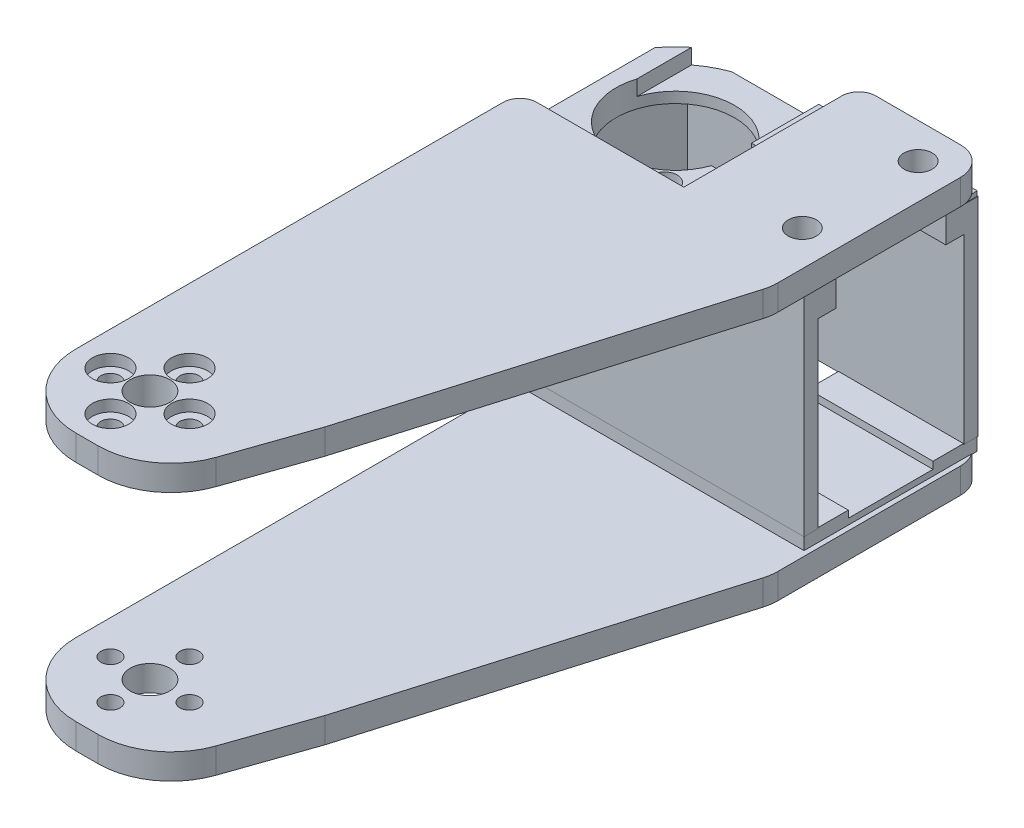
from build123d import *

# Parameters (mm, degrees)
BOSS_1_DEPTH    = 4.5
S_CYL2_R        = 9.5
BOSS_2_DEPTH    = 3.2
BOSS_3_DEPTH    = 4.5
S_BOX4_W        = 2.5
S_BOX4_H        = 36.8
BOSS_4_DEPTH    = 30.8
S_BOX5_W        = 51.4
S_BOX5_H        = 36.8
BOSS_5_DEPTH    = 2.5
S_BOX6_W        = 51.4
S_BOX6_H        = 36.8
BOSS_6_DEPTH    = 2.5
S_BOX7_W        = 51.4
S_BOX7_H        = 4.6
BOSS_7_DEPTH    = 30.8
S_BOX8_W        = 22.13
S_BOX8_H        = 2.4
BOSS_8_DEPTH    = 30.66
S_BOX9_W        = 29.16
S_BOX9_H        = 2.4
BOSS_9_DEPTH    = 1.83
S_BOX10_W       = 22.13
S_BOX10_H       = 0.95
BOSS_10_DEPTH   = 30.66
S_BOX11_W       = 29.16
S_BOX11_H       = 0.95
BOSS_11_DEPTH   = 1.83
S_HOLE12_R      = 3.5
HOLE_12_DEPTH   = 4.7
S_HOLE13_R      = 1.7
HOLE_13_DEPTH   = 4.7
S_HOLE14_R      = 1.7
HOLE_14_DEPTH   = 4.7
S_HOLE15_R      = 1.7
HOLE_15_DEPTH   = 4.7
S_HOLE16_R      = 1.7
HOLE_16_DEPTH   = 4.7
S_HOLE17_R      = 3.2
HOLE_17_DEPTH   = 1.6
S_HOLE18_R      = 3.2
HOLE_18_DEPTH   = 1.6
S_HOLE19_R      = 3.2
HOLE_19_DEPTH   = 1.6
S_HOLE20_R      = 3.2
HOLE_20_DEPTH   = 1.6
S_HOLE21_R      = 3.5
HOLE_21_DEPTH   = 7.9
S_HOLE22_R      = 1.7
HOLE_22_DEPTH   = 7.9
S_HOLE23_R      = 1.7
HOLE_23_DEPTH   = 7.9
S_HOLE24_R      = 1.7
HOLE_24_DEPTH   = 7.9
S_HOLE25_R      = 1.7
HOLE_25_DEPTH   = 7.9
S_HOLE26_R      = 3.2
HOLE_26_DEPTH   = 2.1
S_HOLE27_R      = 3.2
HOLE_27_DEPTH   = 2.1
S_HOLE28_R      = 3.2
HOLE_28_DEPTH   = 2.1
S_HOLE29_R      = 3.2
HOLE_29_DEPTH   = 2.1
S_CUT30_W       = 6.8
S_CUT30_H       = 1
POCKET_30_DEPTH = 10
S_HOLE31_R      = 10.5
HOLE_31_DEPTH   = 4.8
S_CUT32_W       = 19.5
S_CUT32_H       = 4.75
POCKET_32_DEPTH = 19.4
S_CUT33_W       = 8.3
S_CUT33_H       = 4.75
POCKET_33_DEPTH = 19.4
S_CUT34_W       = 11
S_CUT34_H       = 4.75
POCKET_34_DEPTH = 7
S_CUT35_W       = 20
S_CUT35_H       = 2.9
POCKET_35_DEPTH = 15.9
S_HOLE36_R      = 1.1
HOLE_36_DEPTH   = 4.8
S_HOLE37_R      = 2.3
HOLE_37_DEPTH   = 1.7
S_HOLE38_R      = 1.1
HOLE_38_DEPTH   = 4.8
S_HOLE39_R      = 2.3
HOLE_39_DEPTH   = 1.7
S_HOLE40_R      = 1.1
HOLE_40_DEPTH   = 4.8
S_HOLE41_R      = 2.3
HOLE_41_DEPTH   = 1.7
S_CUT42_W       = 30.6
S_CUT42_H       = 1.55
POCKET_42_DEPTH = 15
S_HOLE43_R      = 2.5
HOLE_43_DEPTH   = 5.3
S_HOLE44_R      = 2.5
HOLE_44_DEPTH   = 5.3
CUT_45_DEPTH    = 4.9
CUT_46_DEPTH    = 32


with BuildPart() as part:
    # S_prism1 → Boss_1 (new body)
    with BuildSketch(Plane(origin=(0, -23.3, 0), x_dir=(1, 0, 0), z_dir=(0, 1, 0))):
        with BuildLine():
            Line((-0.1, -13), (3.8289, -13))
            ThreePointArc((3.8289, -13), (11.303548347, -10.613765629), (16.0129, -4.3379))
            Line((16.0129, -4.3379), (21, 10))
            Line((21, 10), (38.6729, 69.8916))
            ThreePointArc((38.6729, 69.8916), (38.917799599, 71.011897227), (39, 72.1557))
            Line((39, 72.1557), (39, 104.5))
            ThreePointArc((39, 104.5), (37.5355, 108.0355), (34, 109.5))
            Line((34, 109.5), (19, 109.5))
            ThreePointArc((19, 109.5), (16.8787, 108.6213), (16, 106.5))
            Line((16, 106.5), (16, 78.5))
            Line((16, 78.5), (-10, 78.5))
            ThreePointArc((-10, 78.5), (-12.1213, 77.6213), (-13, 75.5))
            Line((-13, 75.5), (-13, -0.1))
            ThreePointArc((-13, -0.1), (-9.2217, -9.2217), (-0.1, -13))
        make_face()
    extrude(amount=BOSS_1_DEPTH)



with BuildPart() as body_2:
    # S_cyl2 → Boss_2 (new body)
    with BuildSketch(Plane(origin=(0, 17.75, 0), x_dir=(1, 0, 0), z_dir=(0, 1, 0))):
        Circle(S_CYL2_R)
    extrude(amount=BOSS_2_DEPTH)

    # S_prism3 → Boss_3 (add)
    with BuildSketch(Plane(origin=(0, 20.95, 0), x_dir=(1, 0, 0), z_dir=(0, 1, 0))):
        with BuildLine():
            Line((-0.1, -13), (3.8289, -13))
            ThreePointArc((3.8289, -13), (11.303548347, -10.613765629), (16.0129, -4.3379))
            Line((16.0129, -4.3379), (21, 10))
            Line((21, 10), (38.6729, 69.8916))
            ThreePointArc((38.6729, 69.8916), (38.917799599, 71.011897227), (39, 72.1557))
            Line((39, 72.1557), (39, 104.5))
            ThreePointArc((39, 104.5), (37.5355, 108.0355), (34, 109.5))
            Line((34, 109.5), (19, 109.5))
            ThreePointArc((19, 109.5), (16.8787, 108.6213), (16, 106.5))
            Line((16, 106.5), (16, 78.5))
            Line((16, 78.5), (-10, 78.5))
            ThreePointArc((-10, 78.5), (-12.1213, 77.6213), (-13, 75.5))
            Line((-13, 75.5), (-13, -0.1))
            ThreePointArc((-13, -0.1), (-9.2217, -9.2217), (-0.1, -13))
        make_face()
    extrude(amount=BOSS_3_DEPTH)


with BuildPart() as body_3:
    # S_box4 → Boss_4 (new body)
    with BuildSketch(Plane.XY.offset(-108.4)):
        with Locations((-11.95, 1.8)):
            Rectangle(S_BOX4_W, S_BOX4_H)
    extrude(amount=BOSS_4_DEPTH)

    # S_box5 → Boss_5 (add)
    with BuildSketch(Plane.XY.offset(-108.4)):
        with Locations((12.5, 1.8)):
            Rectangle(S_BOX5_W, S_BOX5_H)
    extrude(amount=BOSS_5_DEPTH)

    # S_box6 → Boss_6 (add)
    with BuildSketch(Plane.XY.offset(-80.1)):
        with Locations((12.5, 1.8)):
            Rectangle(S_BOX6_W, S_BOX6_H)
    extrude(amount=BOSS_6_DEPTH)

    # S_box7 → Boss_7 (add)
    with BuildSketch(Plane.XY.offset(-108.4)):
        with Locations((12.5, 17.9)):
            Rectangle(S_BOX7_W, S_BOX7_H)
    extrude(amount=BOSS_7_DEPTH)


with BuildPart() as part_1:
    add(part.part)

    add(body_3.part)  # Boss_8 merges body 3
    # S_box8 → Boss_8 (add)
    with BuildSketch(Plane.XY.offset(-108.33)):
        with Locations((27.065, -17.7)):
            Rectangle(S_BOX8_W, S_BOX8_H)
    extrude(amount=BOSS_8_DEPTH)

    # S_box9 → Boss_9 (add)
    with BuildSketch(Plane.XY.offset(-79.5)):
        with Locations((1.45, -17.7)):
            Rectangle(S_BOX9_W, S_BOX9_H)
    extrude(amount=BOSS_9_DEPTH)


    add(body_2.part)  # Boss_10 merges body 2
    # S_box10 → Boss_10 (add)
    with BuildSketch(Plane.XY.offset(-108.33)):
        with Locations((27.065, 20.575)):
            Rectangle(S_BOX10_W, S_BOX10_H)
    extrude(amount=BOSS_10_DEPTH)

    # S_box11 → Boss_11 (add)
    with BuildSketch(Plane.XY.offset(-79.5)):
        with Locations((1.45, 20.575)):
            Rectangle(S_BOX11_W, S_BOX11_H)
    extrude(amount=BOSS_11_DEPTH)

    # S_hole12 → Hole_12 (cut)
    with BuildSketch(Plane(origin=(0, -23.4, 0), x_dir=(1, 0, 0), z_dir=(0, 1, 0))):
        Circle(S_HOLE12_R)
    extrude(amount=HOLE_12_DEPTH, mode=Mode.SUBTRACT)

    # S_hole13 → Hole_13 (cut)
    with BuildSketch(Plane(origin=(0, -23.4, 0), x_dir=(1, 0, 0), z_dir=(0, 1, 0))):
        with Locations((7, 0)):
            Circle(S_HOLE13_R)
    extrude(amount=HOLE_13_DEPTH, mode=Mode.SUBTRACT)

    # S_hole14 → Hole_14 (cut)
    with BuildSketch(Plane(origin=(0, -23.4, 0), x_dir=(1, 0, 0), z_dir=(0, 1, 0))):
        with Locations((0, -7)):
            Circle(S_HOLE14_R)
    extrude(amount=HOLE_14_DEPTH, mode=Mode.SUBTRACT)

    # S_hole15 → Hole_15 (cut)
    with BuildSketch(Plane(origin=(0, -23.4, 0), x_dir=(1, 0, 0), z_dir=(0, 1, 0))):
        with Locations((-7, 0)):
            Circle(S_HOLE15_R)
    extrude(amount=HOLE_15_DEPTH, mode=Mode.SUBTRACT)

    # S_hole16 → Hole_16 (cut)
    with BuildSketch(Plane(origin=(0, -23.4, 0), x_dir=(1, 0, 0), z_dir=(0, 1, 0))):
        with Locations((0, 7)):
            Circle(S_HOLE16_R)
    extrude(amount=HOLE_16_DEPTH, mode=Mode.SUBTRACT)

    # S_hole17 → Hole_17 (cut)
    with BuildSketch(Plane(origin=(0, -23.4, 0), x_dir=(1, 0, 0), z_dir=(0, 1, 0))):
        with Locations((7, 0)):
            Circle(S_HOLE17_R)
    extrude(amount=HOLE_17_DEPTH, mode=Mode.SUBTRACT)

    # S_hole18 → Hole_18 (cut)
    with BuildSketch(Plane(origin=(0, -23.4, 0), x_dir=(1, 0, 0), z_dir=(0, 1, 0))):
        with Locations((0, -7)):
            Circle(S_HOLE18_R)
    extrude(amount=HOLE_18_DEPTH, mode=Mode.SUBTRACT)

    # S_hole19 → Hole_19 (cut)
    with BuildSketch(Plane(origin=(0, -23.4, 0), x_dir=(1, 0, 0), z_dir=(0, 1, 0))):
        with Locations((-7, 0)):
            Circle(S_HOLE19_R)
    extrude(amount=HOLE_19_DEPTH, mode=Mode.SUBTRACT)

    # S_hole20 → Hole_20 (cut)
    with BuildSketch(Plane(origin=(0, -23.4, 0), x_dir=(1, 0, 0), z_dir=(0, 1, 0))):
        with Locations((0, 7)):
            Circle(S_HOLE20_R)
    extrude(amount=HOLE_20_DEPTH, mode=Mode.SUBTRACT)

    # S_hole21 → Hole_21 (cut)
    with BuildSketch(Plane(origin=(0, 17.65, 0), x_dir=(1, 0, 0), z_dir=(0, 1, 0))):
        Circle(S_HOLE21_R)
    extrude(amount=HOLE_21_DEPTH, mode=Mode.SUBTRACT)

    # S_hole22 → Hole_22 (cut)
    with BuildSketch(Plane(origin=(0, 17.65, 0), x_dir=(1, 0, 0), z_dir=(0, 1, 0))):
        with Locations((7, 0)):
            Circle(S_HOLE22_R)
    extrude(amount=HOLE_22_DEPTH, mode=Mode.SUBTRACT)

    # S_hole23 → Hole_23 (cut)
    with BuildSketch(Plane(origin=(0, 17.65, 0), x_dir=(1, 0, 0), z_dir=(0, 1, 0))):
        with Locations((0, -7)):
            Circle(S_HOLE23_R)
    extrude(amount=HOLE_23_DEPTH, mode=Mode.SUBTRACT)

    # S_hole24 → Hole_24 (cut)
    with BuildSketch(Plane(origin=(0, 17.65, 0), x_dir=(1, 0, 0), z_dir=(0, 1, 0))):
        with Locations((-7, 0)):
            Circle(S_HOLE24_R)
    extrude(amount=HOLE_24_DEPTH, mode=Mode.SUBTRACT)

    # S_hole25 → Hole_25 (cut)
    with BuildSketch(Plane(origin=(0, 17.65, 0), x_dir=(1, 0, 0), z_dir=(0, 1, 0))):
        with Locations((0, 7)):
            Circle(S_HOLE25_R)
    extrude(amount=HOLE_25_DEPTH, mode=Mode.SUBTRACT)

    # S_hole26 → Hole_26 (cut)
    with BuildSketch(Plane(origin=(0, 23.45, 0), x_dir=(1, 0, 0), z_dir=(0, 1, 0))):
        with Locations((7, 0)):
            Circle(S_HOLE26_R)
    extrude(amount=HOLE_26_DEPTH, mode=Mode.SUBTRACT)

    # S_hole27 → Hole_27 (cut)
    with BuildSketch(Plane(origin=(0, 23.45, 0), x_dir=(1, 0, 0), z_dir=(0, 1, 0))):
        with Locations((0, -7)):
            Circle(S_HOLE27_R)
    extrude(amount=HOLE_27_DEPTH, mode=Mode.SUBTRACT)

    # S_hole28 → Hole_28 (cut)
    with BuildSketch(Plane(origin=(0, 23.45, 0), x_dir=(1, 0, 0), z_dir=(0, 1, 0))):
        with Locations((-7, 0)):
            Circle(S_HOLE28_R)
    extrude(amount=HOLE_28_DEPTH, mode=Mode.SUBTRACT)

    # S_hole29 → Hole_29 (cut)
    with BuildSketch(Plane(origin=(0, 23.45, 0), x_dir=(1, 0, 0), z_dir=(0, 1, 0))):
        with Locations((0, 7)):
            Circle(S_HOLE29_R)
    extrude(amount=HOLE_29_DEPTH, mode=Mode.SUBTRACT)

    # S_cut30 → Pocket_30 (cut)
    with BuildSketch(Plane.XY):
        with Locations((0, 18.15)):
            Rectangle(S_CUT30_W, S_CUT30_H)
    extrude(amount=POCKET_30_DEPTH, mode=Mode.SUBTRACT)

    # S_hole31 → Hole_31 (cut)
    with BuildSketch(Plane(origin=(0, 15.5, 0), x_dir=(1, 0, 0), z_dir=(0, 1, 0))):
        with Locations((0, 93)):
            Circle(S_HOLE31_R)
    extrude(amount=HOLE_31_DEPTH, mode=Mode.SUBTRACT)

    # S_cut32 → Pocket_32 (cut)
    with BuildSketch(Plane.XY.offset(-102.7)):
        with Locations((20.65, 17.925)):
            Rectangle(S_CUT32_W, S_CUT32_H)
    extrude(amount=POCKET_32_DEPTH, mode=Mode.SUBTRACT)

    # S_cut33 → Pocket_33 (cut)
    with BuildSketch(Plane.XY.offset(-102.7)):
        with Locations((34.55, 17.925)):
            Rectangle(S_CUT33_W, S_CUT33_H)
    extrude(amount=POCKET_33_DEPTH, mode=Mode.SUBTRACT)

    # S_cut34 → Pocket_34 (cut)
    with BuildSketch(Plane.XY.offset(-96.5)):
        with Locations((5.5, 17.925)):
            Rectangle(S_CUT34_W, S_CUT34_H)
    extrude(amount=POCKET_34_DEPTH, mode=Mode.SUBTRACT)

    # S_cut35 → Pocket_35 (cut)
    with BuildSketch(Plane.XY.offset(-108.9)):
        with Locations((0, 18.95)):
            Rectangle(S_CUT35_W, S_CUT35_H)
    extrude(amount=POCKET_35_DEPTH, mode=Mode.SUBTRACT)

    # S_hole36 → Hole_36 (cut)
    with BuildSketch(Plane(origin=(0, 15.5, 0), x_dir=(1, 0, 0), z_dir=(0, 1, 0))):
        with Locations((8.3, 82.75)):
            Circle(S_HOLE36_R)
    extrude(amount=HOLE_36_DEPTH, mode=Mode.SUBTRACT)

    # S_hole37 → Hole_37 (cut)
    with BuildSketch(Plane(origin=(0, 18.6, 0), x_dir=(1, 0, 0), z_dir=(0, 1, 0))):
        with Locations((8.3, 82.75)):
            Circle(S_HOLE37_R)
    extrude(amount=HOLE_37_DEPTH, mode=Mode.SUBTRACT)

    # S_hole38 → Hole_38 (cut)
    with BuildSketch(Plane(origin=(0, 15.5, 0), x_dir=(1, 0, 0), z_dir=(0, 1, 0))):
        with Locations((32.75, 103.25)):
            Circle(S_HOLE38_R)
    extrude(amount=HOLE_38_DEPTH, mode=Mode.SUBTRACT)

    # S_hole39 → Hole_39 (cut)
    with BuildSketch(Plane(origin=(0, 18.6, 0), x_dir=(1, 0, 0), z_dir=(0, 1, 0))):
        with Locations((32.75, 103.25)):
            Circle(S_HOLE39_R)
    extrude(amount=HOLE_39_DEPTH, mode=Mode.SUBTRACT)

    # S_hole40 → Hole_40 (cut)
    with BuildSketch(Plane(origin=(0, 15.5, 0), x_dir=(1, 0, 0), z_dir=(0, 1, 0))):
        with Locations((32.75, 82.75)):
            Circle(S_HOLE40_R)
    extrude(amount=HOLE_40_DEPTH, mode=Mode.SUBTRACT)

    # S_hole41 → Hole_41 (cut)
    with BuildSketch(Plane(origin=(0, 18.6, 0), x_dir=(1, 0, 0), z_dir=(0, 1, 0))):
        with Locations((32.75, 82.75)):
            Circle(S_HOLE41_R)
    extrude(amount=HOLE_41_DEPTH, mode=Mode.SUBTRACT)

    # S_cut42 → Pocket_42 (cut)
    with BuildSketch(Plane.XY.offset(-100.5)):
        with Locations((23.4, -16.975)):
            Rectangle(S_CUT42_W, S_CUT42_H)
    extrude(amount=POCKET_42_DEPTH, mode=Mode.SUBTRACT)

    # S_hole43 → Hole_43 (cut)
    with BuildSketch(Plane(origin=(0, 20.25, 0), x_dir=(1, 0, 0), z_dir=(0, 1, 0))):
        with Locations((32.75, 103.25)):
            Circle(S_HOLE43_R)
    extrude(amount=HOLE_43_DEPTH, mode=Mode.SUBTRACT)

    # S_hole44 → Hole_44 (cut)
    with BuildSketch(Plane(origin=(0, 20.25, 0), x_dir=(1, 0, 0), z_dir=(0, 1, 0))):
        with Locations((32.75, 82.75)):
            Circle(S_HOLE44_R)
    extrude(amount=HOLE_44_DEPTH, mode=Mode.SUBTRACT)

    # S_pcut45 → Cut_45 (cut)
    with BuildSketch(Plane(origin=(0, 15.5, 0), x_dir=(1, 0, 0), z_dir=(0, 1, 0))):
        with BuildLine():
            Line((0.5, 109.308), (0.5, 113))
            Line((0.5, 113), (-20, 113))
            Line((-20, 113), (-20, 93))
            Line((-20, 93), (-16.3, 93))
            ThreePointArc((-16.3, 93), (-11.34548413, 104.703431775), (0.5, 109.308))
        make_face()
    extrude(amount=CUT_45_DEPTH, mode=Mode.SUBTRACT)

    # S_pcut46 → Cut_46 (cut)
    with BuildSketch(Plane(origin=(0, -16.4, 0), x_dir=(1, 0, 0), z_dir=(0, 1, 0))):
        with BuildLine():
            Line((0.5, 111.508), (0.5, 113))
            Line((0.5, 113), (-20, 113))
            Line((-20, 113), (-20, 93))
            Line((-20, 93), (-18.5, 93))
            ThreePointArc((-18.5, 93), (-12.901369895, 106.259080398), (0.5, 111.508))
        make_face()
    extrude(amount=CUT_46_DEPTH, mode=Mode.SUBTRACT)


solid = part_1.part
